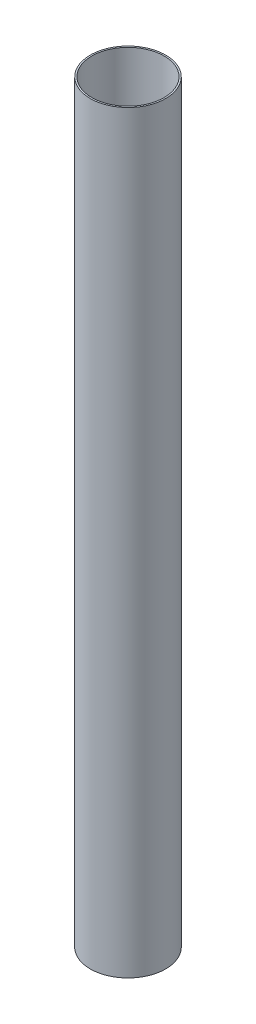
from build123d import *

# Parameters (mm, degrees)
SKETCH1_R           = 304.8
SKETCH1_R_2         = 292.1
BOSS_EXTRUDE1_DEPTH = 6096


with BuildPart() as part:
    # Sketch1 → Boss-Extrude1 (new body)
    with BuildSketch(Plane(origin=(0, 0, 0), x_dir=(1, 0, 0), z_dir=(0, 1, 0))):
        Circle(SKETCH1_R)
        Circle(SKETCH1_R_2, mode=Mode.SUBTRACT)
    extrude(amount=BOSS_EXTRUDE1_DEPTH)


solid = part.part
